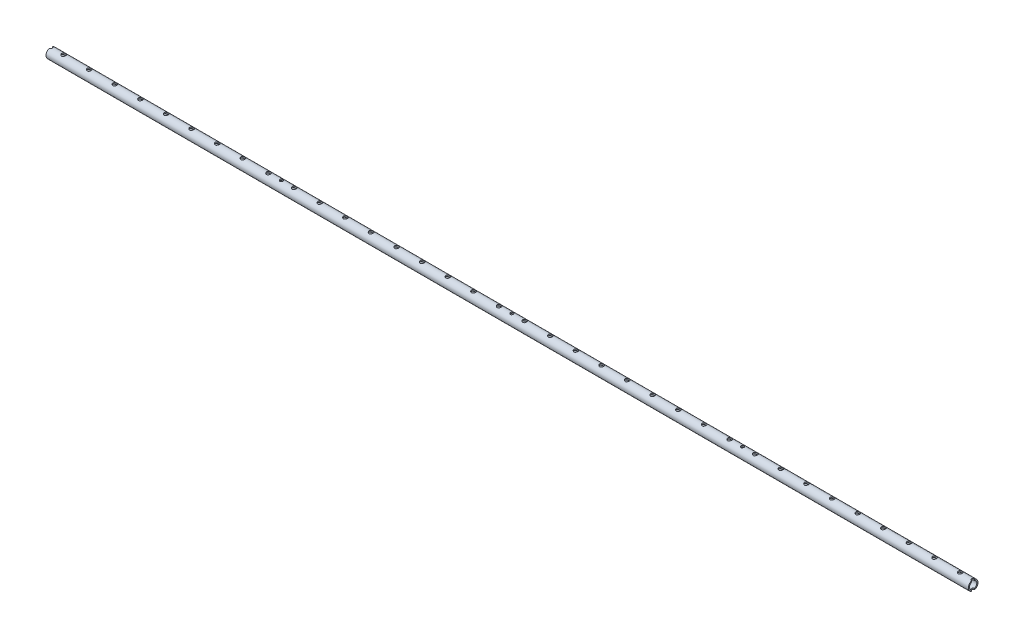
from build123d import *

# Parameters (mm, degrees)
SKETCH1_R               = 9.525
SKETCH1_R_2             = 7.112
BOSS_EXTRUDE1_DEPTH     = 1800
SKETCH2_R               = 4
CUT_EXTRUDE1_DEPTH      = 20
CUT_EXTRUDE2_DEPTH      = 20
CUT_EXTRUDE2_DEPTH_BACK = 20
SKETCH3_R               = 3


with BuildPart() as part:
    # Sketch1 → Boss-Extrude1 (new body)
    with BuildSketch(Plane(origin=(0, 0, 0), x_dir=(0, 0, -1), z_dir=(1, 0, 0))):
        Circle(SKETCH1_R)
        Circle(SKETCH1_R_2, mode=Mode.SUBTRACT)
    extrude(amount=BOSS_EXTRUDE1_DEPTH)

    # Sketch2 → Cut-Extrude1 (cut)
    with BuildSketch(Plane(origin=(0, 0, 0), x_dir=(1, 0, 0), z_dir=(0, 1, 0))):
        with Locations((25, 0)):
            Circle(SKETCH2_R)
        with Locations((75, 0)):
            Circle(SKETCH2_R)
        with Locations((125, 0)):
            Circle(SKETCH2_R)
        with Locations((175, 0)):
            Circle(SKETCH2_R)
        with Locations((225, 0)):
            Circle(SKETCH2_R)
        with Locations((275, 0)):
            Circle(SKETCH2_R)
        with Locations((325, 0)):
            Circle(SKETCH2_R)
        with Locations((375, 0)):
            Circle(SKETCH2_R)
        with Locations((425, 0)):
            Circle(SKETCH2_R)
        with Locations((475, 0)):
            Circle(SKETCH2_R)
        with Locations((525, 0)):
            Circle(SKETCH2_R)
        with Locations((575, 0)):
            Circle(SKETCH2_R)
        with Locations((625, 0)):
            Circle(SKETCH2_R)
        with Locations((675, 0)):
            Circle(SKETCH2_R)
        with Locations((725, 0)):
            Circle(SKETCH2_R)
        with Locations((775, 0)):
            Circle(SKETCH2_R)
        with Locations((825, 0)):
            Circle(SKETCH2_R)
        with Locations((875, 0)):
            Circle(SKETCH2_R)
        with Locations((925, 0)):
            Circle(SKETCH2_R)
        with Locations((975, 0)):
            Circle(SKETCH2_R)
        with Locations((1025, 0)):
            Circle(SKETCH2_R)
        with Locations((1075, 0)):
            Circle(SKETCH2_R)
        with Locations((1125, 0)):
            Circle(SKETCH2_R)
        with Locations((1175, 0)):
            Circle(SKETCH2_R)
        with Locations((1225, 0)):
            Circle(SKETCH2_R)
        with Locations((1275, 0)):
            Circle(SKETCH2_R)
        with Locations((1325, 0)):
            Circle(SKETCH2_R)
        with Locations((1375, 0)):
            Circle(SKETCH2_R)
        with Locations((1425, 0)):
            Circle(SKETCH2_R)
        with Locations((1475, 0)):
            Circle(SKETCH2_R)
        with Locations((1525, 0)):
            Circle(SKETCH2_R)
        with Locations((1575, 0)):
            Circle(SKETCH2_R)
        with Locations((1625, 0)):
            Circle(SKETCH2_R)
        with Locations((1675, 0)):
            Circle(SKETCH2_R)
        with Locations((1725, 0)):
            Circle(SKETCH2_R)
        with Locations((1775, 0)):
            Circle(SKETCH2_R)
    extrude(amount=CUT_EXTRUDE1_DEPTH, mode=Mode.SUBTRACT)

    # Sketch3 → Cut-Extrude2 (cut, two sides: drawn at the far end of the back side and taken through both)
    with BuildSketch(Plane(origin=(0, 0, 0), x_dir=(1, 0, 0), z_dir=(0, 1, 0)).offset(-CUT_EXTRUDE2_DEPTH_BACK)):
        with Locations((450, 0)):
            Circle(SKETCH3_R)
        Circle(SKETCH3_R)
        with Locations((1800, 0)):
            Circle(SKETCH3_R)
        with Locations((900, 0)):
            Circle(SKETCH3_R)
        with Locations((1350, 0)):
            Circle(SKETCH3_R)
    extrude(amount=CUT_EXTRUDE2_DEPTH + CUT_EXTRUDE2_DEPTH_BACK, mode=Mode.SUBTRACT)


solid = part.part
